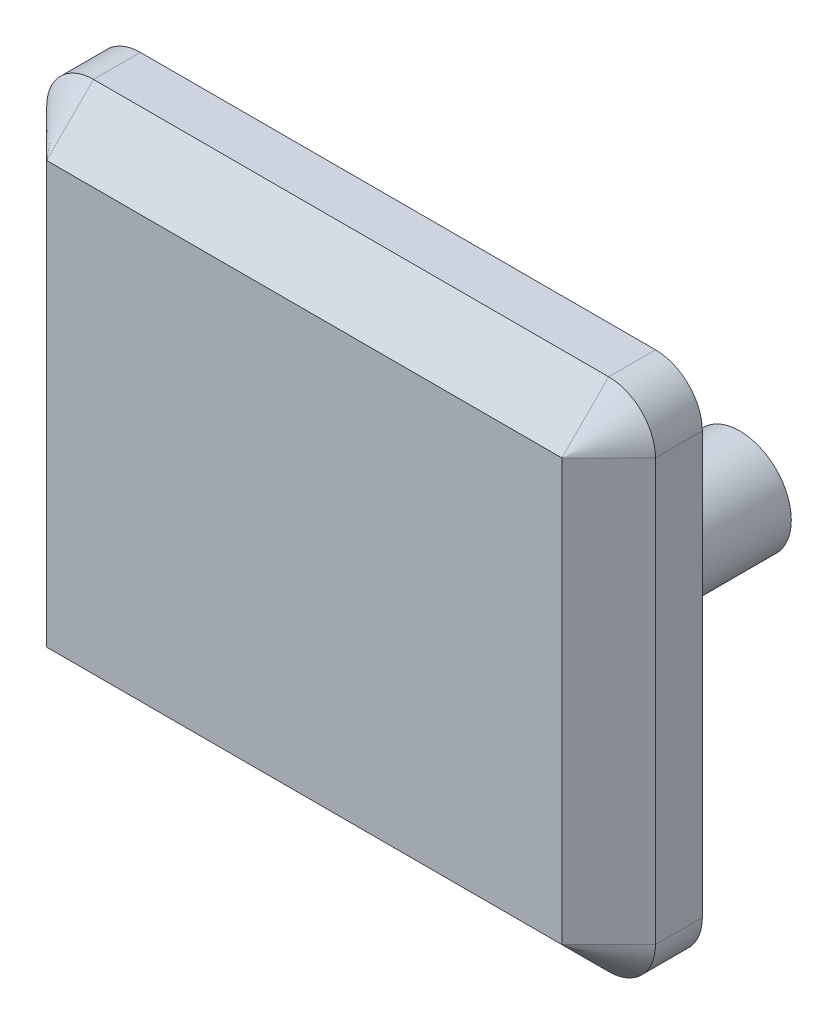
from build123d import *

# Parameters (mm, degrees)
EXTRUDE_1_DEPTH = 1
CHAMFER_1_SIZE  = 0.5
SKETCH_2_R      = 0.55
EXTRUDE_2_DEPTH = 1.9


with BuildPart() as part:
    # 草图1 → 凸台-拉伸1 (new body)
    with BuildSketch(Plane.XY):
        with BuildLine():
            Line((-7.237622799, 4.594383921), (-12.737622799, 4.594383921))
            ThreePointArc((-12.737622799, 4.594383921), (-13.091176189, 4.74083053), (-13.237622799, 5.094383921))
            Line((-13.237622799, 5.094383921), (-13.237622799, 9.594383921))
            ThreePointArc((-13.237622799, 9.594383921), (-13.091176189, 9.947937312), (-12.737622799, 10.094383921))
            Line((-12.737622799, 10.094383921), (-7.237622799, 10.094383921))
            ThreePointArc((-7.237622799, 10.094383921), (-6.884069408, 9.947937312), (-6.737622799, 9.594383921))
            Line((-6.737622799, 9.594383921), (-6.737622799, 5.094383921))
            ThreePointArc((-6.737622799, 5.094383921), (-6.884069408, 4.74083053), (-7.237622799, 4.594383921))
        make_face()
    extrude(amount=EXTRUDE_1_DEPTH)

    # 倒角1
    chamfer_1_edges = [part.edges().sort_by_distance(p)[0] for p in [
        (-13.091176189, 9.947937312, 1),
        (-13.237622799, 7.344383921, 1),
        (-13.091176189, 4.74083053, 1),
        (-9.987622799, 4.594383921, 1),
        (-6.884069408, 4.74083053, 1),
        (-6.737622799, 7.344383921, 1),
        (-6.884069408, 9.947937312, 1),
        (-9.987622799, 10.094383921, 1),
    ]]
    chamfer(chamfer_1_edges, length=CHAMFER_1_SIZE - 0.0001)  # a hair under: the kernel refuses the full size

    # 草图2 → 凸台-拉伸2 (add)
    with BuildSketch(Plane(origin=(0, 0, 0), x_dir=(-1, 0, 0), z_dir=(0, 0, -1))):
        with Locations(Location((11.737622799, 7.344383921, 0), (0, 0, 180))):
            Circle(SKETCH_2_R)
        with Locations(Location((8.237622799, 7.344383921, 0), (0, 0, 180))):
            Circle(SKETCH_2_R)
    extrude(amount=EXTRUDE_2_DEPTH)


solid = part.part
